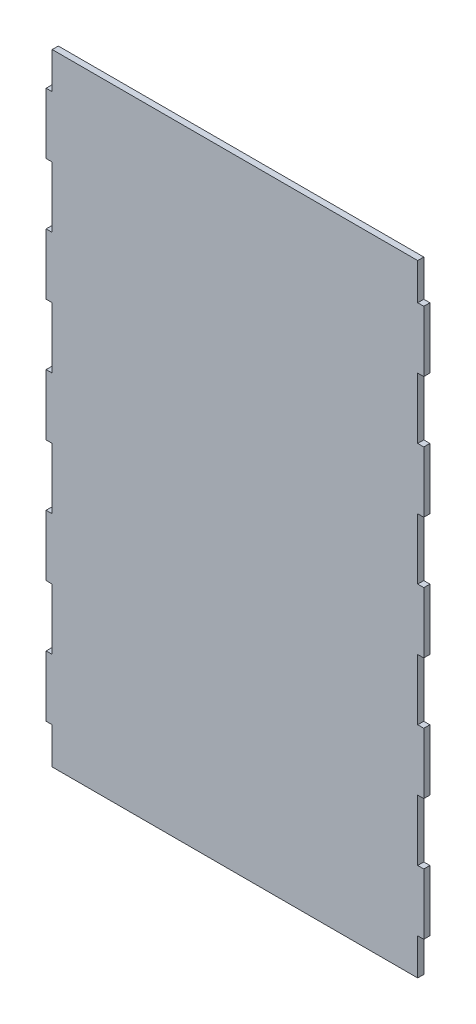
from build123d import *

# Parameters (mm, degrees)
SKETCH_1_W          = 310
SKETCH_1_H          = 510
EXTRUDE_1_DEPTH     = 5
SKETCH_2_W          = 5
SKETCH_2_H          = 50
CUT_EXTRUDE_1_DEPTH = 5


with BuildPart() as part:
    # ｽｹｯﾁ1 → ﾎﾞｽ - 押し出し1 (new body)
    with BuildSketch(Plane.XY):
        Rectangle(SKETCH_1_W, SKETCH_1_H)
    extrude(amount=EXTRUDE_1_DEPTH)

    # ｽｹｯﾁ2 → ｶｯﾄ - 押し出し1 (cut)
    with BuildSketch(Plane.XY.offset(5)):
        with Locations((152.5, 50)):
            Rectangle(SKETCH_2_W, SKETCH_2_H)
        with Locations((152.5, -50)):
            Rectangle(SKETCH_2_W, SKETCH_2_H)
        with Locations((152.5, 150)):
            Rectangle(SKETCH_2_W, SKETCH_2_H)
        with Locations((152.5, -150)):
            Rectangle(SKETCH_2_W, SKETCH_2_H)
        with Locations((152.5, 250)):
            Rectangle(SKETCH_2_W, SKETCH_2_H)
        with Locations((152.5, -250)):
            Rectangle(SKETCH_2_W, SKETCH_2_H)
        with Locations((-152.5, 50)):
            Rectangle(SKETCH_2_W, SKETCH_2_H)
        with Locations((-152.5, -50)):
            Rectangle(SKETCH_2_W, SKETCH_2_H)
        with Locations((-152.5, 150)):
            Rectangle(SKETCH_2_W, SKETCH_2_H)
        with Locations((-152.5, -150)):
            Rectangle(SKETCH_2_W, SKETCH_2_H)
        with Locations((-152.5, 250)):
            Rectangle(SKETCH_2_W, SKETCH_2_H)
        with Locations((-152.5, -250)):
            Rectangle(SKETCH_2_W, SKETCH_2_H)
    extrude(amount=-CUT_EXTRUDE_1_DEPTH, mode=Mode.SUBTRACT)


solid = part.part
